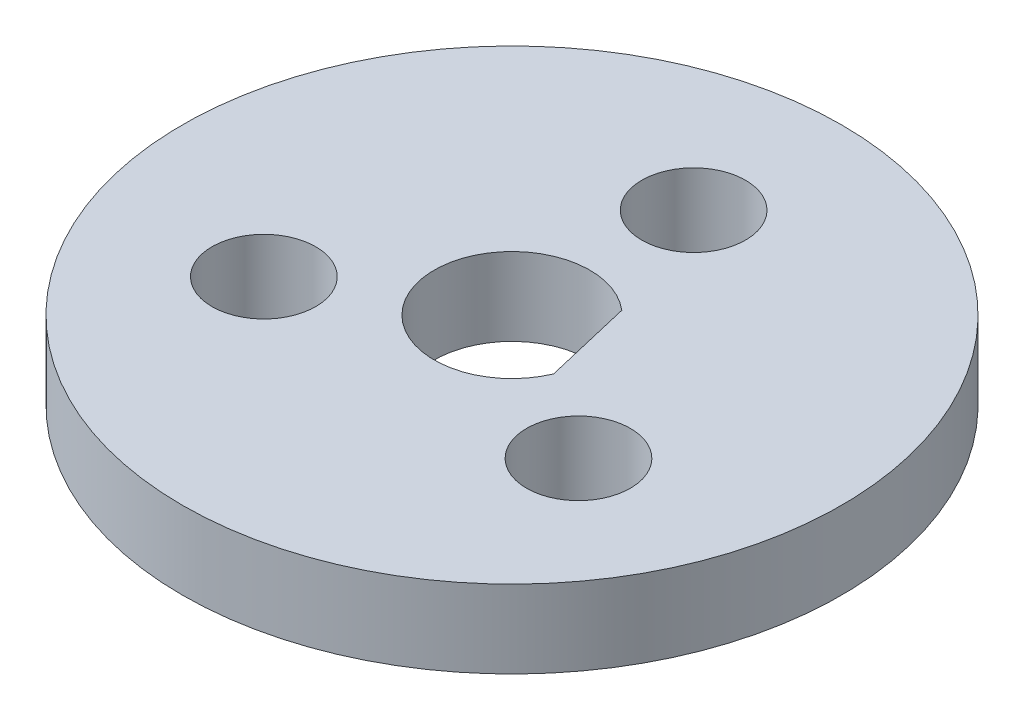
from build123d import *

# Parameters (mm, degrees)
SKETCH1_R           = 12.7
BOSS_EXTRUDE1_DEPTH = 3
CUT_EXTRUDE1_DEPTH  = 10
SKETCH3_R           = 2
CUT_EXTRUDE2_DEPTH  = 5


with BuildPart() as part:
    # Sketch1 → Boss-Extrude1 (new body)
    with BuildSketch(Plane(origin=(0, 0, 0), x_dir=(1, 0, 0), z_dir=(0, 1, 0))):
        Circle(SKETCH1_R)
    extrude(amount=BOSS_EXTRUDE1_DEPTH)

    # Sketch2 → Cut-Extrude1 (cut)
    with BuildSketch(Plane(origin=(0, 3, 0), x_dir=(1, 0, 0), z_dir=(0, 1, 0))):
        with BuildLine():
            Line((2.765935685, -1.161722767), (1.956504764, 2.274222748))
            ThreePointArc((1.956504764, 2.274222748), (-2.92006701, -0.687901633), (2.765935685, -1.161722767))
        make_face()
    extrude(amount=-CUT_EXTRUDE1_DEPTH, mode=Mode.SUBTRACT)

    # Sketch3 → Cut-Extrude2 (cut)
    with BuildSketch(Plane(origin=(0, 3, 0), x_dir=(1, 0, 0), z_dir=(0, 1, 0))):
        with Locations((0, 7)):
            Circle(SKETCH3_R)
        with Locations((6.062177826, -3.5)):
            Circle(SKETCH3_R)
        with Locations((-6.062177826, -3.5)):
            Circle(SKETCH3_R)
    extrude(amount=-CUT_EXTRUDE2_DEPTH, mode=Mode.SUBTRACT)


solid = part.part
